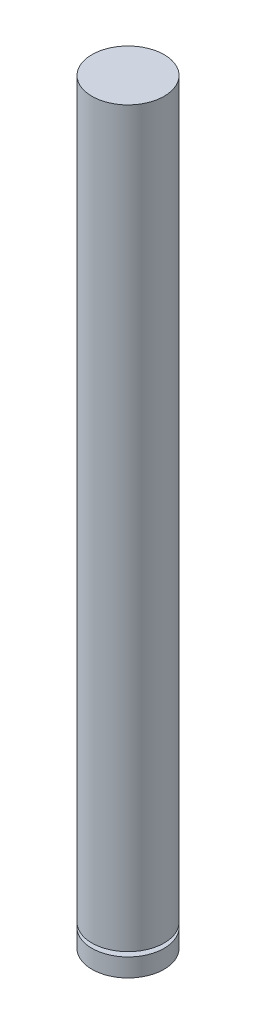
from build123d import *

# Parameters (mm, degrees)
SKETCH1_R           = 1.585
BOSS_EXTRUDE1_DEPTH = 33.2
SKETCH2_W           = 0.5
SKETCH2_H           = 0.2


with BuildPart() as part:
    # Sketch1 → Boss-Extrude1 (new body)
    with BuildSketch(Plane(origin=(0, 0, 0), x_dir=(1, 0, 0), z_dir=(0, 1, 0))):
        Circle(SKETCH1_R)
    extrude(amount=BOSS_EXTRUDE1_DEPTH)

    # Sketch2 → Cut-Revolve1 (revolve, cut)
    with BuildSketch(Plane.XY):
        with Locations((1.335, 0.9)):
            Rectangle(SKETCH2_W, SKETCH2_H)
    revolve(axis=Axis((0, -1.7, 0), (0, 1, 0)), mode=Mode.SUBTRACT)


solid = part.part
